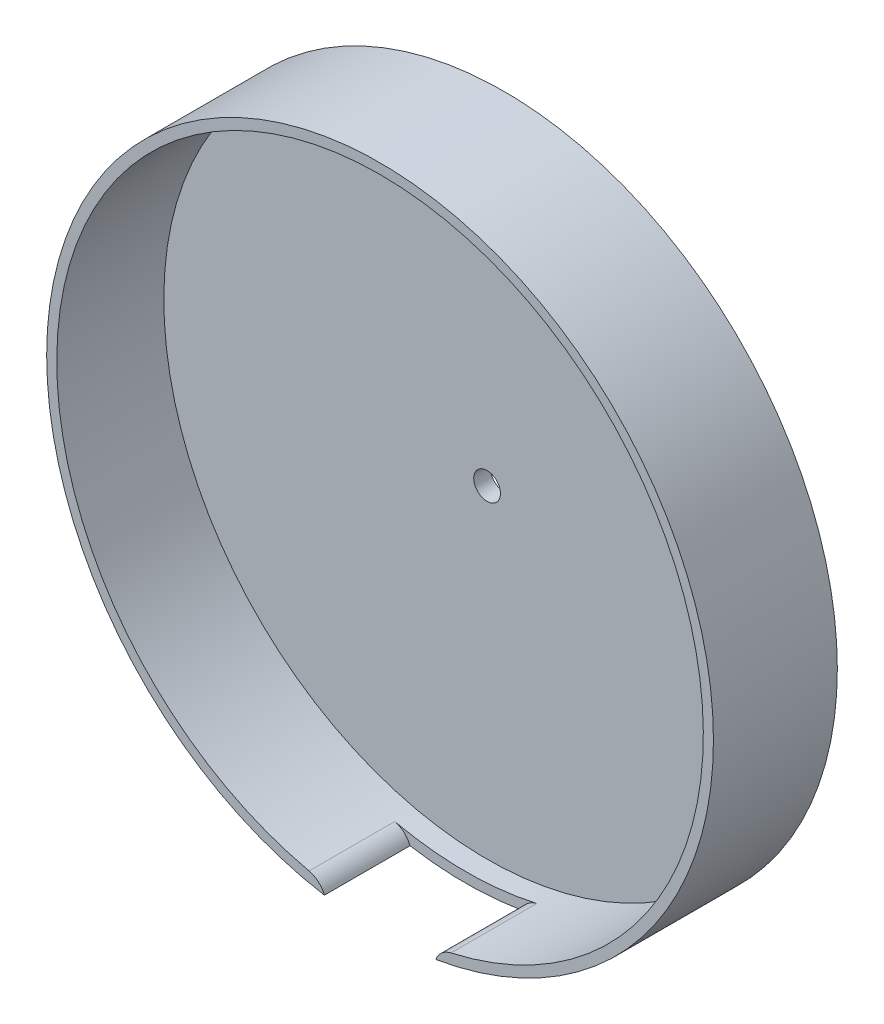
from build123d import *

# Parameters (mm, degrees)
SKETCH2_R           = 39.554
SKETCH2_R_2         = 38.354
BOSS_EXTRUDE1_DEPTH = 12.7
BOSS_EXTRUDE2_START = -2
SKETCH2_2_R         = 39.554
BOSS_EXTRUDE2_DEPTH = 2
SKETCH4_R           = 1.5875
CUT_EXTRUDE1_DEPTH  = 58.837080078
CUT_EXTRUDE3_REACH  = 59.361
SKETCH5_W           = 13.208
SKETCH5_H           = 10.16
FILLET1_R           = 2.54


with BuildPart() as part:
    # Sketch2 → Boss-Extrude1 (new body)
    with BuildSketch(Plane.XY):
        Circle(SKETCH2_R)
        Circle(SKETCH2_R_2, mode=Mode.SUBTRACT)
    extrude(amount=BOSS_EXTRUDE1_DEPTH)

    # Sketch2<2> → Boss-Extrude2 (add)
    with BuildSketch(Plane.XY.offset(BOSS_EXTRUDE2_START)):
        Circle(SKETCH2_2_R)
    extrude(amount=BOSS_EXTRUDE2_DEPTH)

    # Sketch4 → Cut-Extrude1 (cut, through all)
    with BuildSketch(Plane(origin=(0, 0, -2), x_dir=(-1, 0, 0), z_dir=(0, 0, -1))):
        Circle(SKETCH4_R)
    extrude(amount=-CUT_EXTRUDE1_DEPTH, mode=Mode.SUBTRACT)

    # Sketch5 → Cut-Extrude3 (cut, up to next)
    with BuildSketch(Plane(origin=(0, 0, 0), x_dir=(1, 0, 0), z_dir=(0, 1, 0)), mode=Mode.PRIVATE) as cut_extrude3_sk1:
        with Locations((0, -7.62)):
            Rectangle(SKETCH5_W, SKETCH5_H)
    cut_extrude3_tool1 = extrude(cut_extrude3_sk1.sketch, amount=-CUT_EXTRUDE3_REACH, mode=Mode.PRIVATE) & part.part
    add(cut_extrude3_tool1.solids().sort_by_distance((0, 0, 7.62))[0], mode=Mode.SUBTRACT)

    # Fillet1
    # the kernel refuses this fillet: 2.54 mm, written as the material it takes off along each edge
    with BuildSketch(Plane(origin=(-6.604, -37.781165943, 17.336288805), x_dir=(0, -1, 0), z_dir=(0, 0, -1))) as fillet1_piece_1:
        with BuildLine():
            CenterArc((2.114605309, 2.376349225), FILLET1_R, 192.685578689, 56.634940698)
            Line((-0.363392905, 1.818563559), (-0.41295287, 1.807407846))
            ThreePointArc((-0.41295287, 1.807407846), (-0.220518494, 0.901524198), (-0.050041279, -0.00874702))
            Line((-0.050041279, -0.00874702), (0, -0.0508))
            ThreePointArc((0, -0.0508), (0.608815096, -0.0508), (1.19969069, -0.047526985))
            Line((1.19969069, -0.047526985), (1.217630192, 0))
        make_face()
    extrude(amount=14.796288805, mode=Mode.SUBTRACT)
    with BuildSketch(Plane(origin=(6.604, -37.781165943, 17.336288805), x_dir=(0, -1, 0), z_dir=(0, 0, -1))) as fillet1_piece_2:
        with BuildLine():
            CenterArc((2.114605309, -2.376349225), FILLET1_R, 110.679480614, 56.634940698)
            Line((-0.363392905, -1.818563559), (-0.41295287, -1.807407846))
            ThreePointArc((-0.41295287, -1.807407846), (-0.220518494, -0.901524198), (-0.050041279, 0.00874702))
            Line((-0.050041279, 0.00874702), (0, 0.0508))
            ThreePointArc((0, 0.0508), (0.608815096, 0.0508), (1.19969069, 0.047526985))
            Line((1.19969069, 0.047526985), (1.217630192, 0))
        make_face()
    extrude(amount=14.796288805, mode=Mode.SUBTRACT)


solid = part.part
